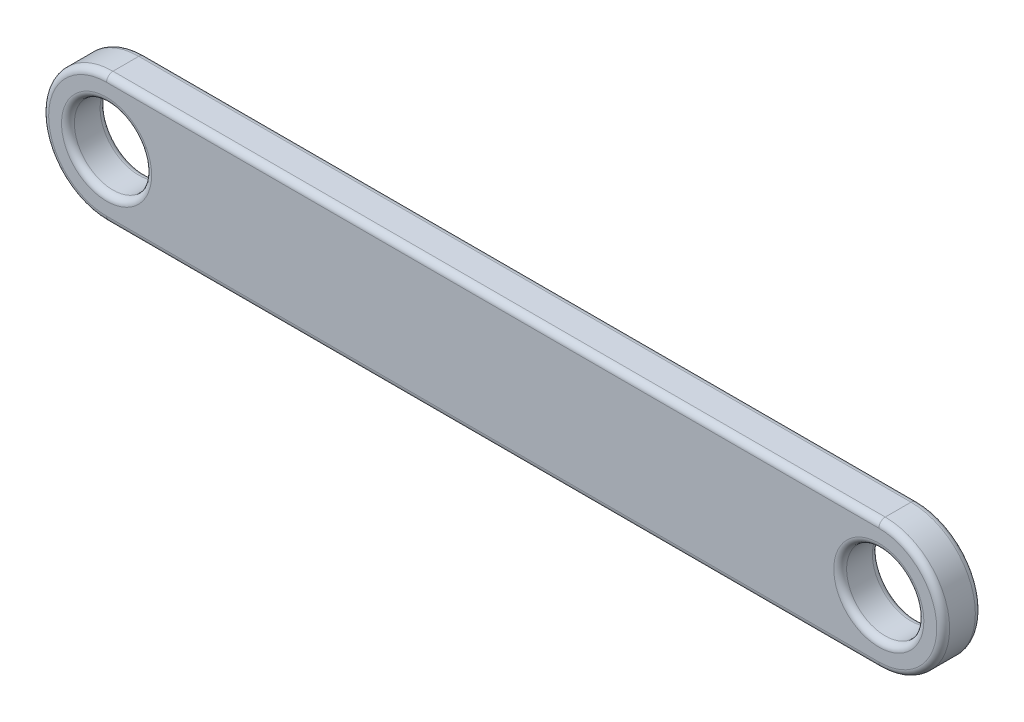
from build123d import *

# Parameters (mm, degrees)
SKETCH_1_R      = 3
EXTRUDE_1_DEPTH = 3
FILLET_1_R      = 0.5


with BuildPart() as part:
    # ｽｹｯﾁ1 → ﾎﾞｽ - 押し出し1 (new body)
    with BuildSketch(Plane.XY):
        with BuildLine():
            Line((0, 5), (60, 5))
            ThreePointArc((60, 5), (65, 0), (60, -5))
            Line((60, -5), (0, -5))
            ThreePointArc((0, -5), (-5, 0), (0, 5))
        make_face()
        Circle(SKETCH_1_R, mode=Mode.SUBTRACT)
        with Locations((60, 0)):
            Circle(SKETCH_1_R, mode=Mode.SUBTRACT)
    extrude(amount=EXTRUDE_1_DEPTH)

    # ﾌｨﾚｯﾄ1
    fillet_1_edges = [part.edges().sort_by_distance(p)[0] for p in [
        (57, 0, 0),
        (30, -5, 0),
        (65, 0, 0),
        (30, 5, 0),
        (-5, 0, 0),
        (-3, 0, 0),
        (57, 0, 3),
        (30, 5, 3),
        (65, 0, 3),
        (30, -5, 3),
        (-5, 0, 3),
        (-3, 0, 3),
    ]]
    fillet(fillet_1_edges, radius=FILLET_1_R)


solid = part.part
